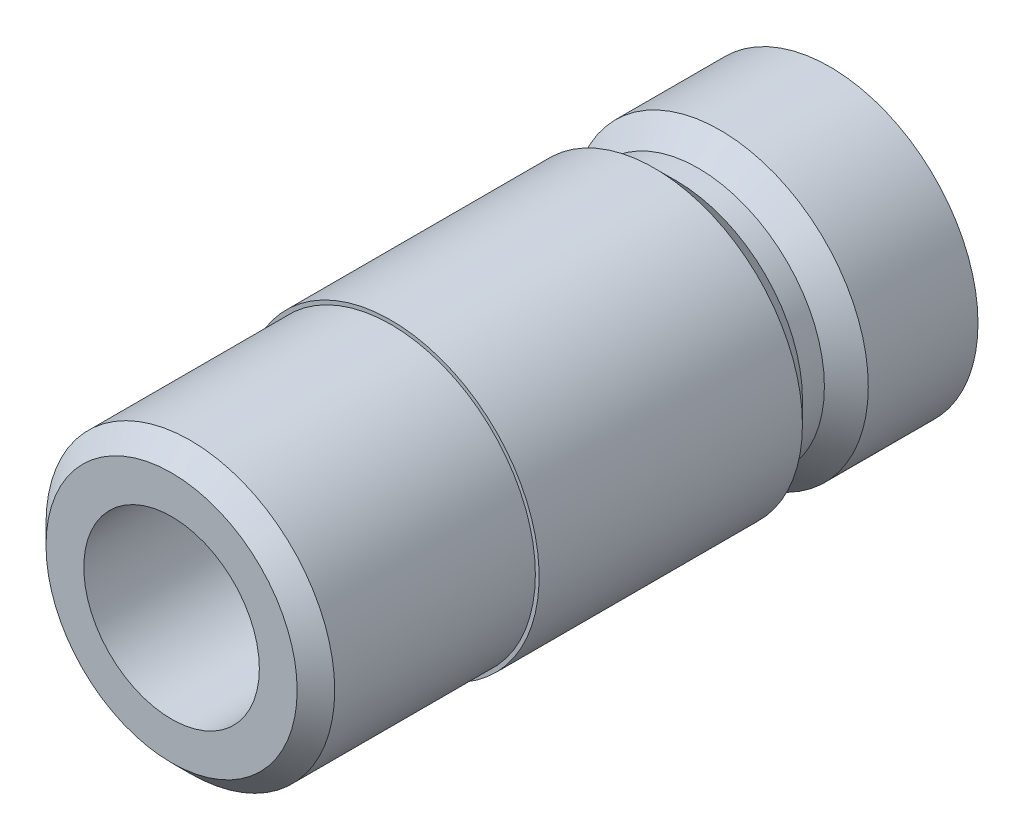
from build123d import *

# Parameters (mm, degrees)
SKETCH_1_R          = 6.75
EXTRUDE_1_DEPTH     = 30
SKETCH_3_R          = 4
CUT_EXTRUDE_1_DEPTH = 32.482137793


# Read off the part's stored shape, not the designer's step: G1/4 直管螺纹 螺柱1
with BuildPart() as part:
    # 草图1 → 凸台-拉伸1 (new body)
    with BuildSketch(Plane.XY):
        Circle(SKETCH_1_R)
    extrude(amount=EXTRUDE_1_DEPTH)

    # 草图2 → 切除-旋转1 (revolve, cut)
    with BuildSketch(Plane(origin=(0, 0, 0), x_dir=(0, 0, -1), z_dir=(1, 0, 0)), mode=Mode.PRIVATE) as cut_revolve_1_sk:
        Polygon((-8, 6.75), (-7, 5.75), (-6, 5.75), (-5, 6.75), align=None)
    revolve(cut_revolve_1_sk.sketch.rotate(Axis((0, 0, 3.925992106), (0, 0, -1)), 90), axis=Axis((0, 0, 3.925992106), (0, 0, -1)), mode=Mode.SUBTRACT)

    # 草图3 → 切除-拉伸1 (cut, through all)
    with BuildSketch(Plane.XY.offset(30)):
        Circle(SKETCH_3_R)
    extrude(amount=-CUT_EXTRUDE_1_DEPTH, mode=Mode.SUBTRACT)

    # G1/4 直管螺纹 螺柱1 outline → G1/4 直管螺纹 螺柱1 (revolve, cut)
    with BuildSketch(Plane.XZ):
        Polygon((6.75, 30), (5.7225, 30), (6.5785, 29.144), (6.5785, 20), (6.75, 20), align=None)
    revolve(axis=Axis((0, 0, 0), (0, 0, 1)), mode=Mode.SUBTRACT)


solid = part.part
